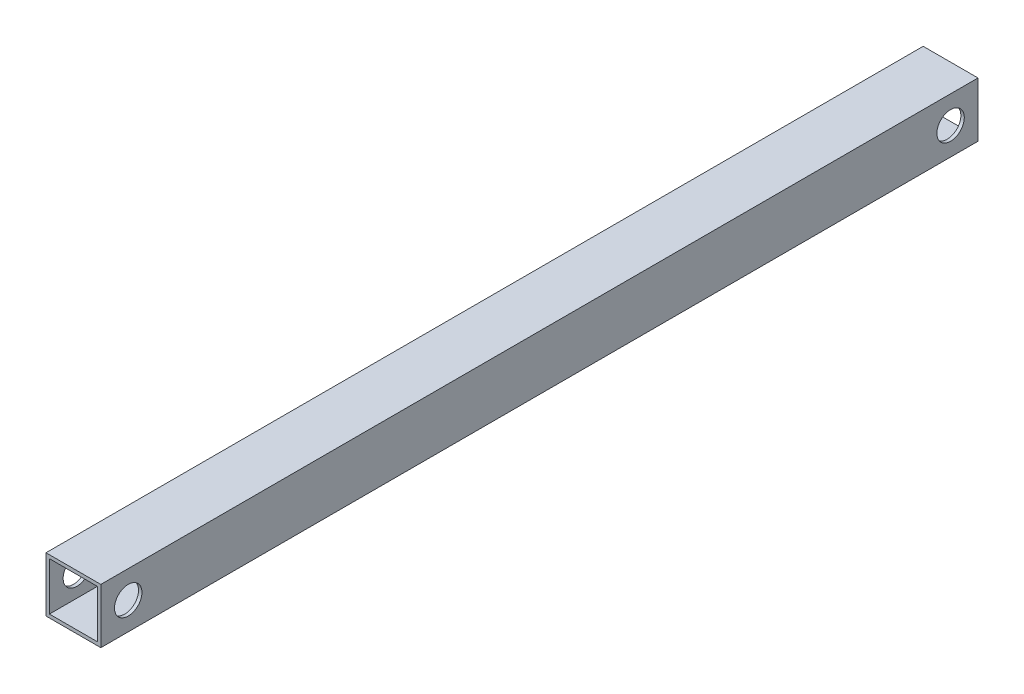
from build123d import *

# Parameters (mm, degrees)
SKETCH1_W           = 25.4
SKETCH1_H           = 25.4
SKETCH1_W_2         = 22.225
SKETCH1_H_2         = 22.225
EXTRUDE_THIN1_DEPTH = 203.2
SKETCH2_R           = 6.35
CUT_EXTRUDE1_DEPTH  = 206.174779152


with BuildPart() as part:
    # Sketch1 → Extrude-Thin1 (new, symmetric)
    with BuildSketch(Plane.XY):
        Rectangle(SKETCH1_W, SKETCH1_H)
        Rectangle(SKETCH1_W_2, SKETCH1_H_2, mode=Mode.SUBTRACT)
    extrude(amount=EXTRUDE_THIN1_DEPTH, both=True)

    # Sketch2 → Cut-Extrude1 (cut, through all)
    with BuildSketch(Plane(origin=(12.7, 0, 0), x_dir=(0, 0, -1), z_dir=(1, 0, 0))):
        with Locations((-190.5, 0)):
            Circle(SKETCH2_R)
        with Locations((190.5, 0)):
            Circle(SKETCH2_R)
    extrude(amount=-CUT_EXTRUDE1_DEPTH, mode=Mode.SUBTRACT)


solid = part.part
